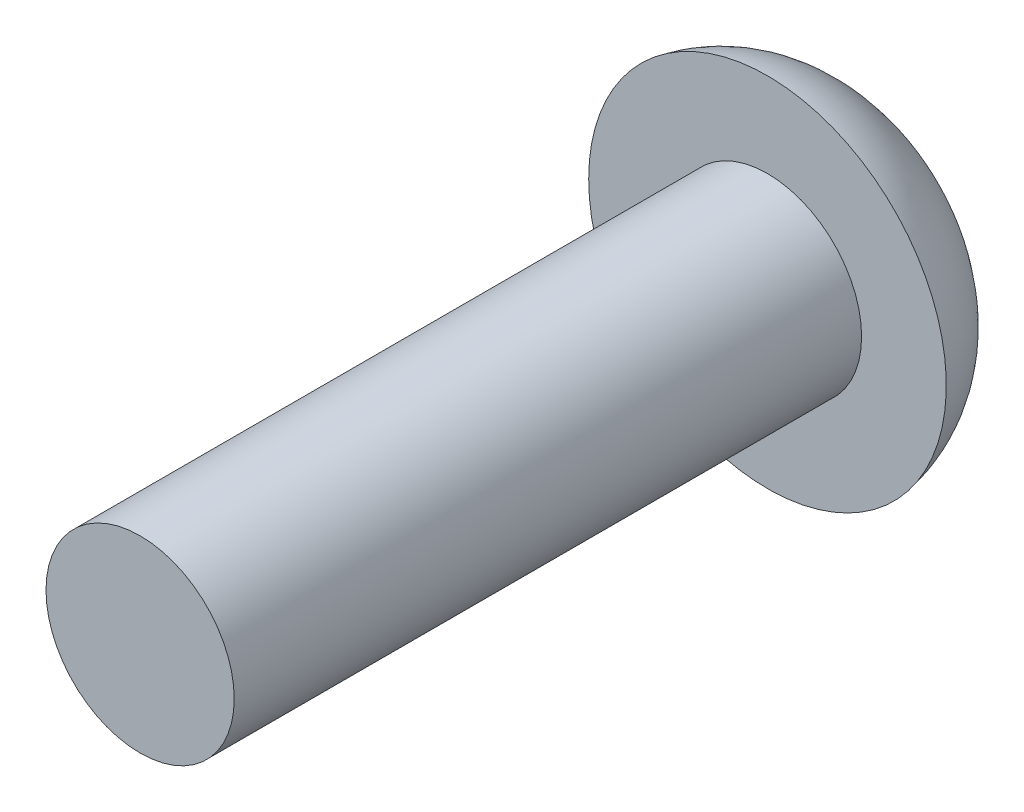
from build123d import *

# Parameters (mm, degrees)
SKETCH_1_R      = 1.5
EXTRUDE_1_DEPTH = 10
SKETCH_2_R      = 2.85
EXTRUDE_2_DEPTH = 1.65
FILLET_1_R      = 2


with BuildPart() as part:
    # 草图1 → 凸台-拉伸1 (new body)
    with BuildSketch(Plane.XY):
        Circle(SKETCH_1_R)
    extrude(amount=EXTRUDE_1_DEPTH)

    # 草图2 → 凸台-拉伸2 (add)
    with BuildSketch(Plane(origin=(0, 0, 0), x_dir=(-1, 0, 0), z_dir=(0, 0, -1))):
        Circle(SKETCH_2_R)
    extrude(amount=EXTRUDE_2_DEPTH)

    # 圆角1
    # the kernel refuses this fillet: 2 mm, written as the material it takes off along each edge
    with BuildSketch(Plane(origin=(0, 0, -1.65), x_dir=(-1, 0, 0), z_dir=(0, -1, 0))) as fillet_1_piece_1:
        with BuildLine():
            CenterArc((0.880863133, -2), FILLET_1_R, 10.078658108, 79.921341892)
            Line((0.880863133, 0), (0.880863133, 0.04))
            Line((0.880863133, 0.04), (2.85, 0.04))
            Line((2.85, 0.04), (2.89, 0))
            ThreePointArc((2.89, 0), (2.89, -0.825), (2.889382737, -1.643))
            Line((2.889382737, -1.643), (2.85, -1.65))
        make_face()
    revolve(axis=Axis((0, 0, -1.65), (0, 0, -1)), mode=Mode.SUBTRACT)


solid = part.part
